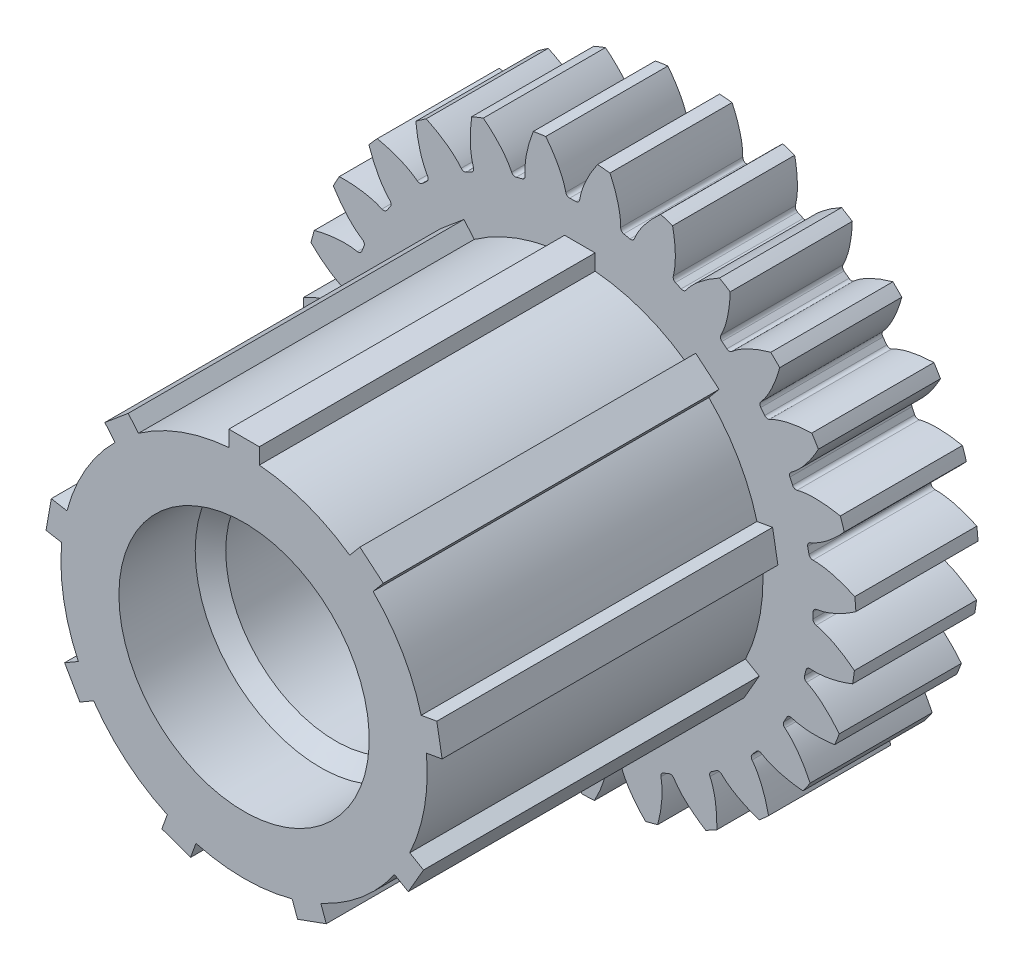
from build123d import *

# Parameters (mm, degrees)
SKETCH2_R                = 18.125
BOSS_EXTRUDE1_DEPTH      = 8
CUT_EXTRUDE1_DEPTH       = 8
FILLET1_R                = 0.254
CIRPATTERN3_COUNT        = 27
FILLET1_OF_CIRPATTERN3_R = 0.254
SKETCH3_R                = 12
BOSS_EXTRUDE2_DEPTH      = 22


# Read off the part's stored shape, not the designer's step: Cut-Extrude1
with BuildPart() as part:
    # Sketch2 → Boss-Extrude1 (new body)
    with BuildSketch(Plane.XY):
        Circle(SKETCH2_R)
    extrude(amount=BOSS_EXTRUDE1_DEPTH)

    # Cut-Extrude1 outline → Cut-Extrude1 (cut)
    with BuildSketch(Plane.XY):
        with BuildLine():
            add(Edge.make_bspline(
                [(15.293943906, 0), (15.305253299, 0), (15.336964339, 0.00074082), (15.396845119, 0.005066139), (15.494240284, 0.016267993), (15.617714722, 0.036610689), (15.776289364, 0.069834677), (15.961506744, 0.117828662), (16.163035486, 0.179773153), (16.379749283, 0.256988095), (16.59342961, 0.342624014), (16.803983292, 0.435958219), (17.011216032, 0.536009953), (17.259008351, 0.665439426), (17.551466226, 0.832023435), (17.793413557, 0.984652677), (17.98203981, 1.112094263), (18.081230118, 1.181579697), (18.086216109, 1.185078834)],
                knots=[0, 0, 0, 0, 0, 0.005376748, 0.015083688, 0.02853182, 0.046610139, 0.064854849, 0.092110525, 0.119476175, 0.146842495, 0.174208853, 0.201574955, 0.228941013, 0.256307345, 0.307035032, 0.361767351, 0.364665932, 0.364665932, 0.364665932, 0.364665932, 0.364665932], degree=4))
            Line((15.293943906, 0), (15.269621682, -0.86219134))
            add(Edge.make_bspline(
                [(17.990644834, -2.202799001), (17.985864036, -2.199024345), (17.890748691, -2.124057592), (17.709606894, -1.986184932), (17.476648761, -1.820158714), (17.194047109, -1.637352405), (16.953945405, -1.49415955), (16.752682616, -1.382584249), (16.547725468, -1.277528577), (16.339212659, -1.179982683), (16.127196474, -1.090673365), (15.929480328, -1.017466265), (15.747263149, -0.959107033), (15.590813683, -0.916996286), (15.468682422, -0.889725108), (15.372073647, -0.873050446), (15.312531935, -0.865356246), (15.280913089, -0.862828904), (15.269621682, -0.86219134)],
                knots=[0.544424984, 0.544424984, 0.544424984, 0.544424984, 0.544424984, 0.547323565, 0.602055884, 0.652783571, 0.680149903, 0.707515961, 0.734882063, 0.762248421, 0.789614741, 0.816980391, 0.844236067, 0.862480777, 0.880559096, 0.894007228, 0.903714168, 0.909090916, 0.909090916, 0.909090916, 0.909090916, 0.909090916], degree=4))
            ThreePointArc((17.990644834, -2.202799001), (18.117792441, -0.511098867), (18.086216109, 1.185078834))
        make_face()
    cut_extrude1 = extrude(amount=CUT_EXTRUDE1_DEPTH, mode=Mode.SUBTRACT)

    # Fillet1
    fillet1_edges = [part.edges().sort_by_distance(p)[0] for p in [
        (15.269621682, -0.86219134, 4),
        (15.293943906, 0, 4),
    ]]
    fillet(fillet1_edges, radius=FILLET1_R)

    # CirPattern3: Cut-Extrude1 ×27 about axis
    cirpattern3_axis = Axis((0, 0, 18.908609159), (0, 0, -1))
    for i in range(1, CIRPATTERN3_COUNT):
        add(cut_extrude1.rotate(cirpattern3_axis, i * 360 / CIRPATTERN3_COUNT), mode=Mode.SUBTRACT)

    # Fillet1 of CirPattern3
    fillet1_of_cirpattern3_edges = [part.edges().sort_by_distance(p)[0] for p in [
        (14.659192047, -4.360367961, 4),
        (14.881693669, -3.527026191, 4),
        (13.258481574, -7.623476016, 4),
        (13.667167474, -6.863909487, 4),
        (11.143002927, -10.475600507, 4),
        (11.715840743, -9.830757646, 4),
        (8.426802109, -12.762982662, 4),
        (9.132910004, -12.267627116, 4),
        (5.256310208, -14.362309119, 4),
        (6.057621724, -14.043145632, 4),
        (1.802449263, -15.187359773, 4),
        (2.655765489, -15.061594533, 4),
        (-1.748582189, -15.193655931, 4),
        (-0.889263752, -15.268068974, 4),
        (-5.205347122, -14.380858165, 4),
        (-4.386352553, -14.651437864, 4),
        (-8.381490444, -12.792784613, 4),
        (-7.646971953, -13.244943947, 4),
        (-11.105785447, -10.515048731, 4),
        (-10.495341116, -11.124411673, 4),
        (-13.231364682, -7.67044385, 4),
        (-12.777903722, -8.404159486, 4),
        (-14.643637622, -4.412323356, 4),
        (-14.371606231, -5.230836887, 4),
        (-15.266468268, -0.916333368, 4),
        (-15.190531729, -1.775518517, 4),
        (-15.066279658, 2.629056389, 4),
        (-15.190531729, 1.775518517, 4),
        (-14.053864011, 6.032713036, 4),
        (-14.371606231, 5.230836887, 4),
        (-12.283800918, 9.111144562, 4),
        (-12.777903722, 8.404159486, 4),
        (-9.851514938, 11.698391926, 4),
        (-10.495341116, 11.124411673, 4),
        (-6.888131238, 13.654975953, 4),
        (-7.646971953, 13.244943947, 4),
        (-3.553406599, 14.875416692, 4),
        (-4.386352553, 14.651437864, 4),
        (-0.027116892, 15.293919867, 4),
        (-0.889263752, 15.268068974, 4),
        (3.500634695, 14.887923863, 4),
        (2.655765489, 15.061594533, 4),
        (6.839666159, 13.67931603, 4),
        (6.057621724, 14.043145632, 4),
        (9.80996945, 11.733252729, 4),
        (9.132910004, 12.267627116, 4),
        (12.251414749, 9.154646737, 4),
        (11.715840743, 9.830757646, 4),
        (14.032383107, 6.082511369, 4),
        (13.667167474, 6.863909487, 4),
        (15.05686206, 2.682466239, 4),
        (14.881693669, 3.527026191, 4),
    ]]
    fillet(fillet1_of_cirpattern3_edges, radius=FILLET1_OF_CIRPATTERN3_R)

    # Sketch3 → Boss-Extrude2 (add)
    with BuildSketch(Plane.XY.offset(8)):
        Circle(SKETCH3_R)
        with BuildLine():
            ThreePointArc((-11.95023607, 1.091722433), (-11.817693036, 2.083778132), (-11.602939715, 3.061337939))
            Line((-11.602939715, 3.061337939), (-12.628852611, 3.242234063))
            Line((-12.628852611, 3.242234063), (-12.976148967, 1.272618557))
            Line((-12.976148967, 1.272618557), (-11.95023607, 1.091722433))
        make_face()
        with BuildLine():
            ThreePointArc((-8.452666282, 8.517771582), (-7.713451316, 9.192533317), (-6.920577396, 9.803346801))
            Line((-6.920577396, 9.803346801), (-7.590194483, 10.60136537))
            Line((-7.590194483, 10.60136537), (-9.122283369, 9.315790151))
            Line((-9.122283369, 9.315790151), (-8.452666282, 8.517771582))
        make_face()
        with BuildLine():
            ThreePointArc((-1, 11.958260743), (0, 12), (1, 11.958260743))
            Line((1, 11.958260743), (1, 13))
            Line((1, 13), (-1, 13))
            Line((-1, 13), (-1, 11.958260743))
        make_face()
        with BuildLine():
            Line((7.590194483, 10.60136537), (6.920577396, 9.803346801))
            ThreePointArc((6.920577396, 9.803346801), (7.713451316, 9.192533317), (8.452666282, 8.517771582))
            Line((8.452666282, 8.517771582), (9.122283369, 9.315790151))
            Line((9.122283369, 9.315790151), (7.590194483, 10.60136537))
        make_face()
        with BuildLine():
            Line((12.628852611, 3.242234063), (11.602939715, 3.061337939))
            ThreePointArc((11.602939715, 3.061337939), (11.817693036, 2.083778132), (11.95023607, 1.091722433))
            Line((11.95023607, 1.091722433), (12.976148967, 1.272618557))
            Line((12.976148967, 1.272618557), (12.628852611, 3.242234063))
        make_face()
        with BuildLine():
            Line((11.758330249, -5.633974596), (10.856157589, -5.113104968))
            ThreePointArc((10.856157589, -5.113104968), (10.392304845, -6), (9.856157589, -6.845155775))
            Line((9.856157589, -6.845155775), (10.758330249, -7.366025404))
            Line((10.758330249, -7.366025404), (11.758330249, -5.633974596))
        make_face()
        with BuildLine():
            Line((5.385954484, -11.873983927), (5.029658674, -10.895069234))
            ThreePointArc((5.029658674, -10.895069234), (4.10424172, -11.276311449), (3.150273432, -11.579109521))
            Line((3.150273432, -11.579109521), (3.506569242, -12.558024214))
            Line((3.506569242, -12.558024214), (5.385954484, -11.873983927))
        make_face()
        with BuildLine():
            ThreePointArc((-3.150273432, -11.579109521), (-4.10424172, -11.276311449), (-5.029658674, -10.895069234))
            Line((-5.029658674, -10.895069234), (-5.385954484, -11.873983927))
            Line((-5.385954484, -11.873983927), (-3.506569242, -12.558024214))
            Line((-3.506569242, -12.558024214), (-3.150273432, -11.579109521))
        make_face()
        with BuildLine():
            ThreePointArc((-9.856157589, -6.845155775), (-10.392304845, -6), (-10.856157589, -5.113104968))
            Line((-10.856157589, -5.113104968), (-11.758330249, -5.633974596))
            Line((-11.758330249, -5.633974596), (-10.758330249, -7.366025404))
            Line((-10.758330249, -7.366025404), (-9.856157589, -6.845155775))
        make_face()
    extrude(amount=BOSS_EXTRUDE2_DEPTH)

    # Sketch4 → Cut-Revolve1 (revolve, cut)
    with BuildSketch(Plane(origin=(0, 0, 0), x_dir=(0, 0, -1), z_dir=(1, 0, 0)), mode=Mode.PRIVATE) as cut_revolve1_sk:
        Polygon((-30, 8.2), (-25, 8.2), (-24, 7.2), (-6, 7.2), (-5, 8.2), (0, 8.2), (0, 0), (-30, 0), align=None)
    revolve(cut_revolve1_sk.sketch.rotate(Axis((0, 0, 0), (0, 0, 1)), 90), axis=Axis((0, 0, 0), (0, 0, 1)), mode=Mode.SUBTRACT)


solid = part.part
